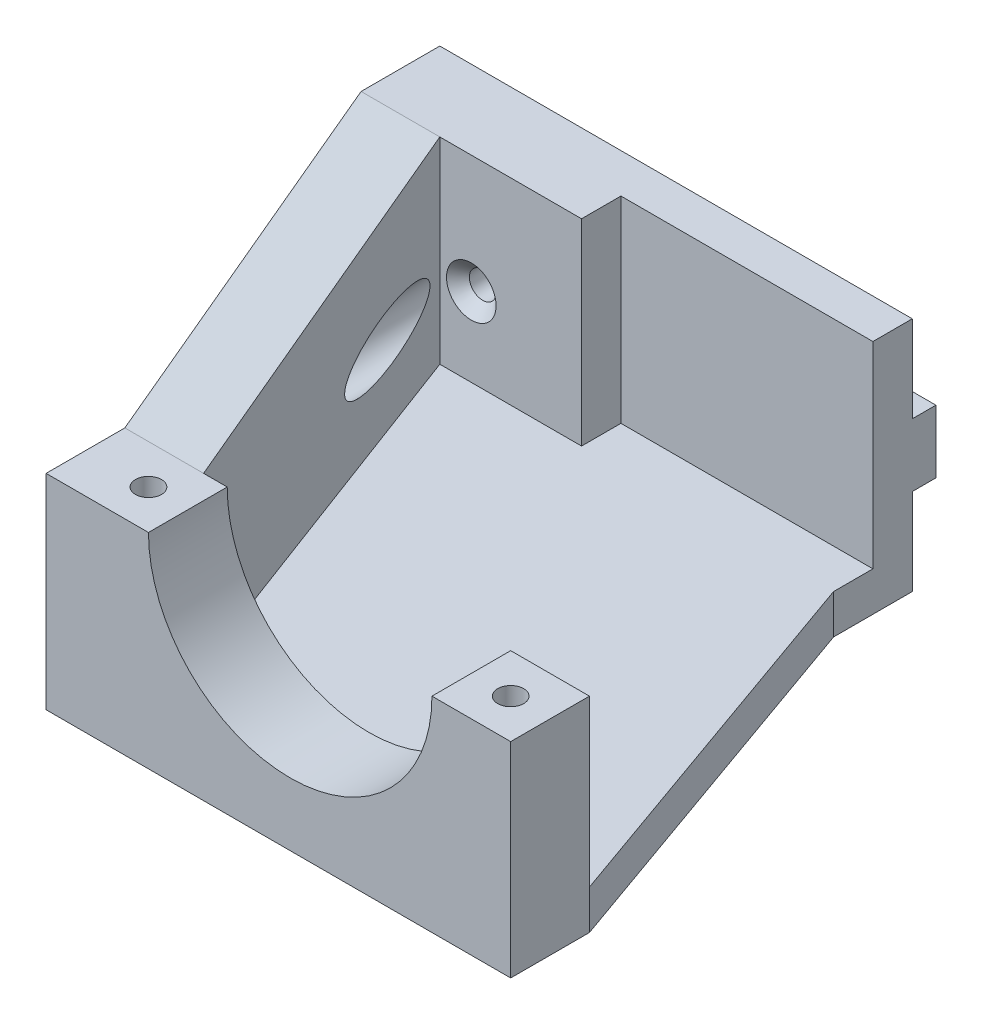
from build123d import *

# Parameters (mm, degrees)
SKETCH_1_W          = 60
SKETCH_1_H          = 30
EXTRUDE_1_DEPTH     = 10
SKETCH_2_W          = 42
SKETCH_2_H          = 42
CUT_EXTRUDE_1_DEPTH = 5
EXTRUDE_2_DEPTH     = 10
CUT_EXTRUDE_2_REACH = 102.96
SKETCH_8_R          = 3.25
SKETCH_9_W          = 5
SKETCH_9_H          = 8
EXTRUDE_3_DEPTH     = 3


# Read off the part's stored shape, not the designer's step: 高级异型孔1, 高级异型孔2
with BuildPart() as part:
    # 草图1 → 凸台-拉伸1 (new body)
    with BuildSketch(Plane.XY):
        with Locations((30, 15)):
            Rectangle(SKETCH_1_W, SKETCH_1_H)
    extrude(amount=EXTRUDE_1_DEPTH)

    # 草图2 → 切除-拉伸1 (cut)
    with BuildSketch(Plane.XY.offset(10)):
        with Locations((49, 26)):
            Rectangle(SKETCH_2_W, SKETCH_2_H)
    extrude(amount=-CUT_EXTRUDE_1_DEPTH, mode=Mode.SUBTRACT)



with BuildPart() as body_2:
    # 草图3 → 凸台-拉伸2 (new body)
    with BuildSketch(Plane.XY.offset(58)):
        with BuildLine():
            Line((18, 0), (18, 26))
            Line((18, 26), (31, 26))
            ThreePointArc((31, 26), (49, 8), (67, 26))
            Line((67, 26), (77, 26))
            Line((77, 26), (77, 0))
            Line((77, 0), (18, 0))
        make_face()
    extrude(amount=EXTRUDE_2_DEPTH)


with BuildPart() as part_1:
    add(part.part)

    add(body_2.part)  # 放样1 merges body 2
    # 草图5 → 放样1 section 0
    with BuildSketch(Plane.XY.offset(10)):
        with BuildLine():
            Line((60, 5), (60, 0))
            Line((60, 0), (0, 0))
            Line((0, 0), (0, 30))
            Line((0, 30), (10, 30))
            Line((10, 30), (10, 5))
            Line((10, 5), (60, 5))
        make_face()
    # 草图4 → 放样1 section 1
    with BuildSketch(Plane(origin=(0, 0, 58), x_dir=(-1, 0, 0), z_dir=(0, 0, -1))):
        with BuildLine():
            Line((-18, 26), (-18, 0))
            Line((-18, 0), (-77, 0))
            Line((-77, 0), (-77, 5))
            Line((-77, 5), (-28, 5))
            Line((-28, 5), (-28, 26))
            Line((-28, 26), (-18, 26))
        make_face()
    loft()

    # 高级异型孔1 outline → 高级异型孔1 (revolve, cut)
    with BuildSketch(Plane(origin=(14, 15, 0), x_dir=(1, 0, 0), z_dir=(0, -1, 0))):
        Polygon((3.15, 10), (0, 10), (0, 0), (1.7, 0), (1.7, 8.55), align=None)
    revolve(axis=Axis((14, 15, 0), (0, 0, 1)), mode=Mode.SUBTRACT)

    # 切除-拉伸2: up to this plane
    cut_extrude_2_end = Plane(origin=(-3.287671233, 0, 1.232876712), z_dir=(-0.9363291775690445, 0, 0.35112344158839154))
    # 草图8 → 切除-拉伸2 (cut, up to the surface)
    with BuildSketch(Plane.XY.offset(10), mode=Mode.PRIVATE) as cut_extrude_2_sk1:
        with Locations(Location((14, 15, 0), (0, 0, 180))):
            Circle(SKETCH_8_R)
    cut_extrude_2_tool1 = split(extrude(cut_extrude_2_sk1.sketch, amount=CUT_EXTRUDE_2_REACH, mode=Mode.PRIVATE), bisect_by=cut_extrude_2_end, keep=Keep.BOTH, mode=Mode.PRIVATE)
    add(cut_extrude_2_tool1.solids().sort_by_distance((14, 15, 10))[0], mode=Mode.SUBTRACT)

    # 草图9 → 凸台-拉伸3 (add)
    with BuildSketch(Plane(origin=(0, 0, 0), x_dir=(-1, 0, 0), z_dir=(0, 0, -1))):
        with Locations((-57.5, 15)):
            Rectangle(SKETCH_9_W, SKETCH_9_H)
        with Locations((-2.5, 15)):
            Rectangle(SKETCH_9_W, SKETCH_9_H)
    extrude(amount=EXTRUDE_3_DEPTH)

    # 高级异型孔2 outline → 高级异型孔2 (revolve, cut)
    with BuildSketch(Plane(origin=(72, 0, 63), x_dir=(1, 0, 0), z_dir=(0, 0, 1))):
        Polygon((0, 15.008579979), (1.65, 16), (1.65, 26), (0, 26), align=None)
    revolve(axis=Axis((72, 0, 63), (0, 1, 0)), mode=Mode.SUBTRACT)

    # Other 2 2 outline → Other 2 2 (revolve, cut)
    with BuildSketch(Plane(origin=(26, 0, 63), x_dir=(1, 0, 0), z_dir=(0, 0, 1))):
        Polygon((0, 15.008579979), (1.65, 16), (1.65, 26), (0, 26), align=None)
    revolve(axis=Axis((26, 0, 63), (0, 1, 0)), mode=Mode.SUBTRACT)


solid = part_1.part
